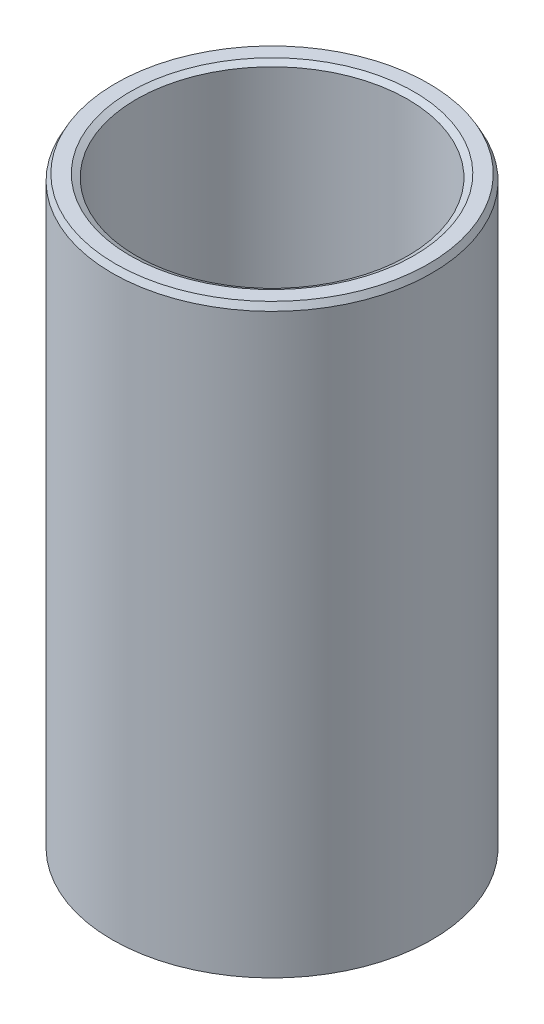
from build123d import *
from OCP.BRepFilletAPI import BRepFilletAPI_MakeChamfer

# Parameters (mm, degrees)
SKETCH1_R           = 50
BOSS_EXTRUDE1_DEPTH = 183.623264003
SKETCH2_R           = 42.45112836
CUT_EXTRUDE1_DEPTH  = 197.767637286
CHAMFER1_SIZE       = 1.962250009
CHAMFER1_SIZE2      = 1.059832798


with BuildPart() as part:
    # Sketch1 → Boss-Extrude1 (new body)
    with BuildSketch(Plane(origin=(0, 0, 0), x_dir=(1, 0, 0), z_dir=(0, 1, 0))):
        Circle(SKETCH1_R)
    extrude(amount=BOSS_EXTRUDE1_DEPTH)

    # Sketch2 → Cut-Extrude1 (cut, through all)
    with BuildSketch(Plane(origin=(0, 0, 0), x_dir=(1, 0, 0), z_dir=(0, 1, 0))):
        Circle(SKETCH2_R)
    extrude(amount=CUT_EXTRUDE1_DEPTH, mode=Mode.SUBTRACT)

    # Chamfer1: one chamfer whose edges measure the first distance from different faces: ONE call of the kernel's chamfer builder (chamfer() names one face for all edges)
    chamfer1_edges_1 = [part.edges().sort_by_distance(p)[0] for p in [
        (-42.45112836, 183.623264003, 0),
    ]]
    chamfer1_side_1 = [part.faces().sort_by_distance(p)[0] for p in [
        (-48.585786438, 183.623264003, 0),
    ]]
    chamfer1_edges_2 = [part.edges().sort_by_distance(p)[0] for p in [
        (-42.45112836, 0, 0),
    ]]
    chamfer1_side_2 = [part.faces().sort_by_distance(p)[0] for p in [
        (-42.45112836, 91.811632001, 0),
    ]]
    chamfer1_edges_3 = [part.edges().sort_by_distance(p)[0] for p in [
        (-50, 0, 0),
    ]]
    chamfer1_side_3 = [part.faces().sort_by_distance(p)[0] for p in [
        (-48.585786438, 0, 0),
    ]]
    chamfer1_edges_4 = [part.edges().sort_by_distance(p)[0] for p in [
        (-50, 183.623264003, 0),
    ]]
    chamfer1_side_4 = [part.faces().sort_by_distance(p)[0] for p in [
        (-50, 91.811632001, 0),
    ]]
    chamfer1 = BRepFilletAPI_MakeChamfer(part.part.solid().wrapped)
    for e in chamfer1_edges_1:
        chamfer1.Add(CHAMFER1_SIZE, CHAMFER1_SIZE2, e.wrapped, chamfer1_side_1[0].wrapped)  # the first distance lies on this face
    for e in chamfer1_edges_2:
        chamfer1.Add(CHAMFER1_SIZE, CHAMFER1_SIZE2, e.wrapped, chamfer1_side_2[0].wrapped)  # the first distance lies on this face
    for e in chamfer1_edges_3:
        chamfer1.Add(CHAMFER1_SIZE, CHAMFER1_SIZE2, e.wrapped, chamfer1_side_3[0].wrapped)  # the first distance lies on this face
    for e in chamfer1_edges_4:
        chamfer1.Add(CHAMFER1_SIZE, CHAMFER1_SIZE2, e.wrapped, chamfer1_side_4[0].wrapped)  # the first distance lies on this face
    add(Compound.cast(chamfer1.Shape()), mode=Mode.REPLACE)


solid = part.part
